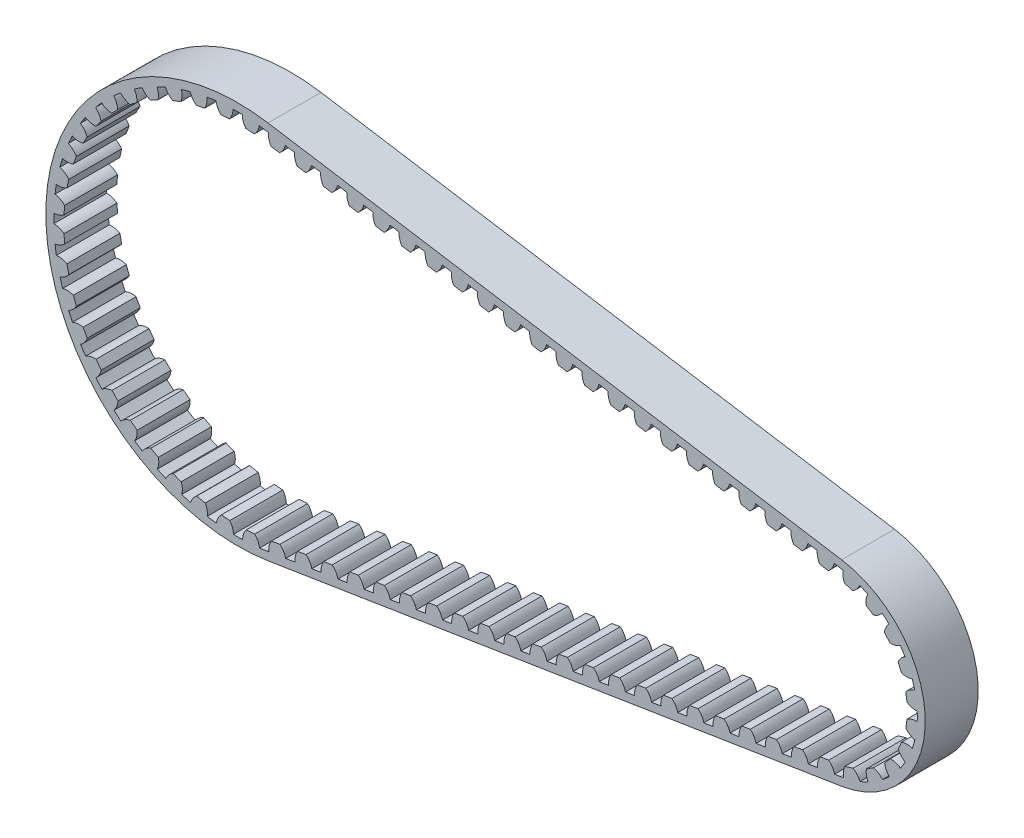
from build123d import *

# Parameters (mm, degrees)
EXTRUDE_1_DEPTH       = 10
EXTRUDE_1_2_DEPTH     = 10
PATTERN_START         = -10
PATTERN_CURVE_1_DEPTH = 10


# Read off the part's stored shape, not the designer's step: ｶｰﾌﾞ ﾊﾟﾀｰﾝ1
with BuildPart() as part:
    # ｽｹｯﾁ1 → Extrude 1 (new body)
    with BuildSketch(Plane.XY):
        with BuildLine():
            Line((5.715115212, -35.821039636), (114.074792623, -18.532651388))
            ThreePointArc((114.074792623, -18.532651388), (129.885019952, 0), (114.074792623, 18.532651388))
            Line((114.074792623, 18.532651388), (5.715115212, 35.821039636))
            ThreePointArc((5.715115212, 35.821039636), (-36.27408748, 0), (5.715115212, -35.821039636))
        make_face()
        with BuildLine():
            Line((5.478784723, -34.339773995), (113.838462135, -17.051385746))
            ThreePointArc((113.838462135, -17.051385746), (128.385019952, 0), (113.838462135, 17.051385746))
            Line((113.838462135, 17.051385746), (5.478784723, 34.339773995))
            ThreePointArc((5.478784723, 34.339773995), (-34.77408748, 0), (5.478784723, -34.339773995))
        make_face(mode=Mode.SUBTRACT)
    extrude(amount=-EXTRUDE_1_DEPTH)

    # ｽｹｯﾁ2 → Extrude 1 2 (add)
    with BuildSketch(Plane.XY):
        with BuildLine():
            Line((11.213338882, 31.490690165), (12.817473575, 31.234756371))
            ThreePointArc((12.817473575, 31.234756371), (13.570424199, 32.128030369), (13.95885104, 33.229845992))
            Line((13.95885104, 33.229845992), (10.749442151, 33.741895384))
            ThreePointArc((10.749442151, 33.741895384), (10.775731123, 32.573913377), (11.213338882, 31.490690165))
        make_face()
    extrude(amount=-EXTRUDE_1_2_DEPTH)

    # ｶｰﾌﾞ ﾊﾟﾀｰﾝ1 outline → ｶｰﾌﾞ ﾊﾟﾀｰﾝ1 (add)
    with BuildSketch(Plane.XY.offset(PATTERN_START)):
        with BuildLine():
            ThreePointArc((15.657944235, 32.715726509), (15.739692363, 31.668982078), (16.150891019, 30.70292187))
            Line((16.150891019, 30.70292187), (17.755025713, 30.446988076))
            ThreePointArc((17.755025713, 30.446988076), (18.44642053, 31.237133548), (18.849827475, 32.20647327))
            Line((18.849827475, 32.20647327), (15.657944235, 32.715726509))
        make_face()
        with BuildLine():
            Line((8.9747232, 33.782009861), (5.782839959, 34.2912631))
            ThreePointArc((5.782839959, 34.2912631), (5.864588088, 33.244518669), (6.275786744, 32.278458461))
            Line((6.275786744, 32.278458461), (7.879921437, 32.022524667))
            ThreePointArc((7.879921437, 32.022524667), (8.571316254, 32.812670139), (8.9747232, 33.782009861))
        make_face()
        with BuildLine():
            ThreePointArc((4.051314082, 34.537284408), (2.444801014, 34.688039842), (0.833024039, 34.764108374))
            ThreePointArc((0.833024039, 34.764108374), (1.012045507, 33.748367512), (1.500316257, 32.839868827))
            Line((1.500316257, 32.839868827), (3.120719704, 32.725663354))
            ThreePointArc((3.120719704, 32.725663354), (3.731591936, 33.556694823), (4.051314082, 34.537284408))
        make_face()
        with BuildLine():
            ThreePointArc((-0.905090499, 34.76230676), (-2.516706316, 34.682897073), (-4.122903406, 34.528811558))
            ThreePointArc((-4.122903406, 34.528811558), (-3.801149121, 33.548886884), (-3.18855542, 32.719123579))
            Line((-3.18855542, 32.719123579), (-1.56839221, 32.836688008))
            ThreePointArc((-1.56839221, 32.836688008), (-1.082005886, 33.746196957), (-0.905090499, 34.76230676))
        make_face()
        with BuildLine():
            ThreePointArc((-5.843070047, 34.279668792), (-7.426980762, 33.971710537), (-8.994900427, 33.590607711))
            ThreePointArc((-8.994900427, 33.590607711), (-8.536963315, 32.666447667), (-7.812517304, 31.932311329))
            Line((-7.812517304, 31.932311329), (-6.225576182, 32.279252387))
            ThreePointArc((-6.225576182, 32.279252387), (-5.873577189, 33.248723838), (-5.843070047, 34.279668792))
        make_face()
        with BuildLine():
            ThreePointArc((-10.66210154, 33.099195622), (-12.186063298, 32.568957941), (-13.683787214, 31.968595958))
            ThreePointArc((-13.683787214, 31.968595958), (-13.098989555, 31.119013777), (-12.277438865, 30.495449306))
            Line((-12.277438865, 30.495449306), (-10.756025376, 31.064704273))
            ThreePointArc((-10.756025376, 31.064704273), (-10.545579398, 32.074402582), (-10.66210154, 33.099195622))
        make_face()
        with BuildLine():
            ThreePointArc((-15.264083391, 31.24491828), (-16.697072726, 30.503195283), (-18.094111554, 29.695795782))
            ThreePointArc((-18.094111554, 29.695795782), (-17.394358141, 28.938086507), (-16.492427176, 28.437787876))
            Line((-16.492427176, 28.437787876), (-15.067512912, 29.217768363))
            ThreePointArc((-15.067512912, 29.217768363), (-15.002904021, 30.247138985), (-15.264083391, 31.24491828))
        make_face()
        with BuildLine():
            ThreePointArc((-19.555332523, 28.754584504), (-20.868177904, 27.816475532), (-22.136091962, 26.81847484))
            ThreePointArc((-22.136091962, 26.81847484), (-21.335627757, 26.168063246), (-20.37167723, 25.801215093))
            Line((-20.37167723, 25.801215093), (-19.072269335, 26.776042947))
            ThreePointArc((-19.072269335, 26.776042947), (-19.154812783, 27.804130863), (-19.555332523, 28.754584504))
        make_face()
        with BuildLine():
            ThreePointArc((-23.448491478, 25.678890309), (-24.61446716, 24.563492555), (-25.727445373, 23.395207087))
            ThreePointArc((-25.727445373, 23.395207087), (-24.842565519, 22.86533368), (-23.836218683, 22.639403976))
            Line((-23.836218683, 22.639403976), (-22.688769355, 23.789234511))
            ThreePointArc((-22.688769355, 23.789234511), (-22.916784795, 24.795110818), (-23.448491478, 25.678890309))
        make_face()
        with BuildLine():
            ThreePointArc((-26.864306766, 22.080447959), (-27.859676845, 20.810467706), (-28.795062188, 19.495680385))
            ThreePointArc((-28.795062188, 19.495680385), (-27.843780286, 19.097131858), (-26.815523461, 19.016719879))
            Line((-26.815523461, 19.016719879), (-25.843391459, 20.318145864))
            ThreePointArc((-25.843391459, 20.318145864), (-26.212237155, 21.281333819), (-26.864306766, 22.080447959))
        make_face()
        with BuildLine():
            ThreePointArc((-29.733242238, 18.032511363), (-30.537743851, 16.633801746), (-31.276494575, 15.199277851))
            ThreePointArc((-31.276494575, 15.199277851), (-30.278175982, 14.940167503), (-29.248941511, 15.006910206))
            Line((-29.248941511, 15.006910206), (-28.47191664, 16.433438359))
            ThreePointArc((-28.47191664, 16.433438359), (-28.974083956, 17.334330234), (-29.733242238, 18.032511363))
        make_face()
        with BuildLine():
            ThreePointArc((-31.996894642, 13.617484838), (-32.594150456, 12.118519551), (-33.121227726, 10.59346185))
            ThreePointArc((-33.121227726, 10.59346185), (-32.09619533, 10.479064421), (-31.086935459, 10.691603118))
            Line((-31.086935459, 10.691603118), (-30.520835704, 12.21419344))
            ThreePointArc((-30.520835704, 12.21419344), (-31.146101963, 13.034449674), (-31.996894642, 13.617484838))
        make_face()
        with BuildLine():
            ThreePointArc((-33.609182543, 8.925245591), (-33.987034151, 7.356539245), (-34.291708195, 5.771993516))
            ThreePointArc((-34.291708195, 5.771993516), (-33.260828699, 5.804637808), (-32.292089048, 6.158645822))
            Line((-32.292089048, 6.158645822), (-31.948438568, 7.746302765))
            ThreePointArc((-31.948438568, 7.746302765), (-32.684075152, 8.469225307), (-33.609182543, 8.925245591))
        make_face()
        with BuildLine():
            ThreePointArc((-34.537284408, 4.051314082), (-34.688039842, 2.444801014), (-34.764108374, 0.833024039))
            ThreePointArc((-34.764108374, 0.833024039), (-33.748367512, 1.012045507), (-32.839868827, 1.500316257))
            Line((-32.839868827, 1.500316257), (-32.725663354, 3.120719704))
            ThreePointArc((-32.725663354, 3.120719704), (-33.556694823, 3.731591936), (-34.537284408, 4.051314082))
        make_face()
        with BuildLine():
            ThreePointArc((-34.76230676, -0.905090499), (-34.682897073, -2.516706316), (-34.528811557, -4.122903406))
            ThreePointArc((-34.528811557, -4.122903406), (-33.548886884, -3.801149121), (-32.719123579, -3.18855542))
            Line((-32.719123579, -3.18855542), (-32.836688008, -1.56839221))
            ThreePointArc((-32.836688008, -1.56839221), (-33.746196957, -1.082005886), (-34.76230676, -0.905090499))
        make_face()
        with BuildLine():
            ThreePointArc((-34.279668792, -5.843070047), (-33.971710537, -7.426980762), (-33.590607711, -8.994900427))
            ThreePointArc((-33.590607711, -8.994900427), (-32.666447667, -8.536963315), (-31.932311329, -7.812517304))
            Line((-31.932311329, -7.812517304), (-32.279252387, -6.225576182))
            ThreePointArc((-32.279252387, -6.225576182), (-33.248723838, -5.873577189), (-34.279668792, -5.843070047))
        make_face()
        with BuildLine():
            ThreePointArc((-33.099195622, -10.66210154), (-32.568957941, -12.186063298), (-31.968595958, -13.683787214))
            ThreePointArc((-31.968595958, -13.683787214), (-31.119013777, -13.098989555), (-30.495449306, -12.277438865))
            Line((-30.495449306, -12.277438865), (-31.064704273, -10.756025376))
            ThreePointArc((-31.064704273, -10.756025376), (-32.074402582, -10.545579398), (-33.099195622, -10.66210154))
        make_face()
        with BuildLine():
            ThreePointArc((-31.24491828, -15.264083391), (-30.503195283, -16.697072726), (-29.695795782, -18.094111554))
            ThreePointArc((-29.695795782, -18.094111554), (-28.938086507, -17.394358141), (-28.437787876, -16.492427176))
            Line((-28.437787876, -16.492427176), (-29.217768363, -15.067512912))
            ThreePointArc((-29.217768363, -15.067512912), (-30.247138985, -15.002904021), (-31.24491828, -15.264083391))
        make_face()
        with BuildLine():
            ThreePointArc((-28.754584504, -19.555332523), (-27.816475532, -20.868177904), (-26.81847484, -22.136091962))
            ThreePointArc((-26.81847484, -22.136091962), (-26.168063246, -21.335627757), (-25.801215093, -20.37167723))
            Line((-25.801215093, -20.37167723), (-26.776042947, -19.072269335))
            ThreePointArc((-26.776042947, -19.072269335), (-27.804130863, -19.154812783), (-28.754584504, -19.555332523))
        make_face()
        with BuildLine():
            ThreePointArc((-25.678890309, -23.448491478), (-24.563492555, -24.61446716), (-23.395207087, -25.727445373))
            ThreePointArc((-23.395207087, -25.727445373), (-22.86533368, -24.842565519), (-22.639403976, -23.836218683))
            Line((-22.639403976, -23.836218683), (-23.789234511, -22.688769355))
            ThreePointArc((-23.789234511, -22.688769355), (-24.795110818, -22.916784795), (-25.678890309, -23.448491478))
        make_face()
        with BuildLine():
            ThreePointArc((-22.080447959, -26.864306766), (-20.810467706, -27.859676845), (-19.495680385, -28.795062188))
            ThreePointArc((-19.495680385, -28.795062188), (-19.097131858, -27.843780286), (-19.016719879, -26.815523461))
            Line((-19.016719879, -26.815523461), (-20.318145864, -25.843391459))
            ThreePointArc((-20.318145864, -25.843391459), (-21.281333819, -26.212237155), (-22.080447959, -26.864306766))
        make_face()
        with BuildLine():
            ThreePointArc((-18.032511363, -29.733242238), (-16.633801746, -30.537743851), (-15.199277851, -31.276494575))
            ThreePointArc((-15.199277851, -31.276494575), (-14.940167503, -30.278175982), (-15.006910206, -29.248941511))
            Line((-15.006910206, -29.248941511), (-16.433438359, -28.47191664))
            ThreePointArc((-16.433438359, -28.47191664), (-17.334330234, -28.974083956), (-18.032511363, -29.733242238))
        make_face()
        with BuildLine():
            ThreePointArc((-13.617484838, -31.996894642), (-12.118519551, -32.594150456), (-10.59346185, -33.121227726))
            ThreePointArc((-10.59346185, -33.121227726), (-10.479064421, -32.09619533), (-10.691603118, -31.086935459))
            Line((-10.691603118, -31.086935459), (-12.21419344, -30.520835704))
            ThreePointArc((-12.21419344, -30.520835704), (-13.034449674, -31.146101963), (-13.617484838, -31.996894642))
        make_face()
        with BuildLine():
            ThreePointArc((-8.925245591, -33.609182543), (-7.356539245, -33.987034151), (-5.771993516, -34.291708195))
            ThreePointArc((-5.771993516, -34.291708195), (-5.804637808, -33.260828699), (-6.158645822, -32.292089048))
            Line((-6.158645822, -32.292089048), (-7.746302765, -31.948438568))
            ThreePointArc((-7.746302765, -31.948438568), (-8.469225307, -32.684075152), (-8.925245591, -33.609182543))
        make_face()
        with BuildLine():
            ThreePointArc((-4.051314082, -34.537284408), (-2.444801014, -34.688039842), (-0.833024039, -34.764108374))
            ThreePointArc((-0.833024039, -34.764108374), (-1.012045507, -33.748367512), (-1.500316257, -32.839868827))
            Line((-1.500316257, -32.839868827), (-3.120719704, -32.725663354))
            ThreePointArc((-3.120719704, -32.725663354), (-3.731591936, -33.556694823), (-4.051314082, -34.537284408))
        make_face()
        with BuildLine():
            ThreePointArc((0.905090499, -34.76230676), (2.516706316, -34.682897073), (4.122903406, -34.528811558))
            ThreePointArc((4.122903406, -34.528811558), (3.801149121, -33.548886884), (3.18855542, -32.719123579))
            Line((3.18855542, -32.719123579), (1.56839221, -32.836688008))
            ThreePointArc((1.56839221, -32.836688008), (1.082005886, -33.746196957), (0.905090499, -34.76230676))
        make_face()
        with BuildLine():
            Line((5.85451991, -34.279826827), (9.04640315, -33.770573588))
            ThreePointArc((9.04640315, -33.770573588), (8.642996205, -32.801233866), (7.951601388, -32.011088394))
            Line((7.951601388, -32.011088394), (6.347466694, -32.267022188))
            ThreePointArc((6.347466694, -32.267022188), (5.936268039, -33.233082396), (5.85451991, -34.279826827))
        make_face()
        with BuildLine():
            Line((10.792072047, -33.492058532), (13.983955288, -32.982805293))
            ThreePointArc((13.983955288, -32.982805293), (13.580548343, -32.013465571), (12.889153526, -31.223320099))
            Line((12.889153526, -31.223320099), (11.285018832, -31.479253893))
            ThreePointArc((11.285018832, -31.479253893), (10.873820176, -32.445314101), (10.792072047, -33.492058532))
        make_face()
        with BuildLine():
            Line((15.729624185, -32.704290237), (18.921507426, -32.195036997))
            ThreePointArc((18.921507426, -32.195036997), (18.518100481, -31.225697275), (17.826705663, -30.435551803))
            Line((17.826705663, -30.435551803), (16.22257097, -30.691485598))
            ThreePointArc((16.22257097, -30.691485598), (15.811372314, -31.657545806), (15.729624185, -32.704290237))
        make_face()
        with BuildLine():
            Line((20.667176323, -31.916521941), (23.859059564, -31.407268702))
            ThreePointArc((23.859059564, -31.407268702), (23.455652618, -30.43792898), (22.764257801, -29.647783508))
            Line((22.764257801, -29.647783508), (21.160123108, -29.903717302))
            ThreePointArc((21.160123108, -29.903717302), (20.748924452, -30.86977751), (20.667176323, -31.916521941))
        make_face()
        with BuildLine():
            Line((25.604728461, -31.128753646), (28.796611701, -30.619500407))
            ThreePointArc((28.796611701, -30.619500407), (28.393204756, -29.650160685), (27.701809939, -28.860015213))
            Line((27.701809939, -28.860015213), (26.097675245, -29.115949007))
            ThreePointArc((26.097675245, -29.115949007), (25.68647659, -30.082009215), (25.604728461, -31.128753646))
        make_face()
        with BuildLine():
            Line((30.542280598, -30.340985351), (33.734163839, -29.831732111))
            ThreePointArc((33.734163839, -29.831732111), (33.330756894, -28.862392389), (32.639362077, -28.072246917))
            Line((32.639362077, -28.072246917), (31.035227383, -28.328180712))
            ThreePointArc((31.035227383, -28.328180712), (30.624028727, -29.29424092), (30.542280598, -30.340985351))
        make_face()
        with BuildLine():
            Line((35.479832736, -29.553217055), (38.671715977, -29.043963816))
            ThreePointArc((38.671715977, -29.043963816), (38.268309032, -28.074624094), (37.576914214, -27.284478622))
            Line((37.576914214, -27.284478622), (35.972779521, -27.540412416))
            ThreePointArc((35.972779521, -27.540412416), (35.561580865, -28.506472624), (35.479832736, -29.553217055))
        make_face()
        with BuildLine():
            Line((40.417384874, -28.76544876), (43.609268115, -28.256195521))
            ThreePointArc((43.609268115, -28.256195521), (43.205861169, -27.286855799), (42.514466352, -26.496710327))
            Line((42.514466352, -26.496710327), (40.910331659, -26.752644121))
            ThreePointArc((40.910331659, -26.752644121), (40.499133003, -27.718704329), (40.417384874, -28.76544876))
        make_face()
        with BuildLine():
            Line((45.354937012, -27.977680465), (48.546820252, -27.468427225))
            ThreePointArc((48.546820252, -27.468427225), (48.143413307, -26.499087503), (47.45201849, -25.708942031))
            Line((47.45201849, -25.708942031), (45.847883796, -25.964875826))
            ThreePointArc((45.847883796, -25.964875826), (45.436685141, -26.930936034), (45.354937012, -27.977680465))
        make_face()
        with BuildLine():
            Line((50.292489149, -27.189912169), (53.48437239, -26.68065893))
            ThreePointArc((53.48437239, -26.68065893), (53.080965445, -25.711319208), (52.389570628, -24.921173736))
            Line((52.389570628, -24.921173736), (50.785435934, -25.17710753))
            ThreePointArc((50.785435934, -25.17710753), (50.374237278, -26.143167738), (50.292489149, -27.189912169))
        make_face()
        with BuildLine():
            Line((55.230041287, -26.402143874), (58.421924528, -25.892890635))
            ThreePointArc((58.421924528, -25.892890635), (58.018517582, -24.923550913), (57.327122765, -24.133405441))
            Line((57.327122765, -24.133405441), (55.722988072, -24.389339235))
            ThreePointArc((55.722988072, -24.389339235), (55.311789416, -25.355399443), (55.230041287, -26.402143874))
        make_face()
        with BuildLine():
            Line((60.167593425, -25.614375579), (63.359476665, -25.10512234))
            ThreePointArc((63.359476665, -25.10512234), (62.95606972, -24.135782617), (62.264674903, -23.345637145))
            Line((62.264674903, -23.345637145), (60.66054021, -23.60157094))
            ThreePointArc((60.66054021, -23.60157094), (60.249341554, -24.567631148), (60.167593425, -25.614375579))
        make_face()
        with BuildLine():
            Line((65.105145563, -24.826607283), (68.297028803, -24.317354044))
            ThreePointArc((68.297028803, -24.317354044), (67.893621858, -23.348014322), (67.202227041, -22.55786885))
            Line((67.202227041, -22.55786885), (65.598092347, -22.813802644))
            ThreePointArc((65.598092347, -22.813802644), (65.186893691, -23.779862852), (65.105145563, -24.826607283))
        make_face()
        with BuildLine():
            Line((70.0426977, -24.038838988), (73.234580941, -23.529585749))
            ThreePointArc((73.234580941, -23.529585749), (72.831173996, -22.560246027), (72.139779179, -21.770100555))
            Line((72.139779179, -21.770100555), (70.535644485, -22.026034349))
            ThreePointArc((70.535644485, -22.026034349), (70.124445829, -22.992094557), (70.0426977, -24.038838988))
        make_face()
        with BuildLine():
            Line((74.980249838, -23.251070693), (78.172133079, -22.741817454))
            ThreePointArc((78.172133079, -22.741817454), (77.768726133, -21.772477732), (77.077331316, -20.982332259))
            Line((77.077331316, -20.982332259), (75.473196623, -21.238266054))
            ThreePointArc((75.473196623, -21.238266054), (75.061997967, -22.204326262), (74.980249838, -23.251070693))
        make_face()
        with BuildLine():
            Line((79.917801976, -22.463302397), (83.109685216, -21.954049158))
            ThreePointArc((83.109685216, -21.954049158), (82.706278271, -20.984709436), (82.014883454, -20.194563964))
            Line((82.014883454, -20.194563964), (80.410748761, -20.450497758))
            ThreePointArc((80.410748761, -20.450497758), (79.999550105, -21.416557966), (79.917801976, -22.463302397))
        make_face()
        with BuildLine():
            Line((84.855354114, -21.675534102), (88.047237354, -21.166280863))
            ThreePointArc((88.047237354, -21.166280863), (87.643830409, -20.196941141), (86.952435592, -19.406795669))
            Line((86.952435592, -19.406795669), (85.348300898, -19.662729463))
            ThreePointArc((85.348300898, -19.662729463), (84.937102242, -20.628789671), (84.855354114, -21.675534102))
        make_face()
        with BuildLine():
            Line((89.792906251, -20.887765807), (92.984789492, -20.378512568))
            ThreePointArc((92.984789492, -20.378512568), (92.581382547, -19.409172846), (91.88998773, -18.619027373))
            Line((91.88998773, -18.619027373), (90.285853036, -18.874961168))
            ThreePointArc((90.285853036, -18.874961168), (89.87465438, -19.841021376), (89.792906251, -20.887765807))
        make_face()
        with BuildLine():
            Line((94.730458389, -20.099997511), (97.92234163, -19.590744272))
            ThreePointArc((97.92234163, -19.590744272), (97.518934684, -18.62140455), (96.827539867, -17.831259078))
            Line((96.827539867, -17.831259078), (95.223405174, -18.087192872))
            ThreePointArc((95.223405174, -18.087192872), (94.812206518, -19.05325308), (94.730458389, -20.099997511))
        make_face()
        with BuildLine():
            Line((99.668010527, -19.312229216), (102.859893767, -18.802975977))
            ThreePointArc((102.859893767, -18.802975977), (102.456486822, -17.833636255), (101.765092005, -17.043490783))
            Line((101.765092005, -17.043490783), (100.160957312, -17.299424577))
            ThreePointArc((100.160957312, -17.299424577), (99.749758656, -18.265484785), (99.668010527, -19.312229216))
        make_face()
        with BuildLine():
            Line((104.605562664, -18.524460921), (107.797445905, -18.015207682))
            ThreePointArc((107.797445905, -18.015207682), (107.39403896, -17.04586796), (106.702644143, -16.255722487))
            Line((106.702644143, -16.255722487), (105.098509449, -16.511656282))
            ThreePointArc((105.098509449, -16.511656282), (104.687310793, -17.47771649), (104.605562664, -18.524460921))
        make_face()
        with BuildLine():
            Line((109.543114802, -17.736692625), (112.734998043, -17.227439386))
            ThreePointArc((112.734998043, -17.227439386), (112.331591098, -16.258099664), (111.64019628, -15.467954192))
            Line((111.64019628, -15.467954192), (110.036061587, -15.723887986))
            ThreePointArc((110.036061587, -15.723887986), (109.624862931, -16.689948194), (109.543114802, -17.736692625))
        make_face()
        with BuildLine():
            ThreePointArc((114.45213302, -16.942083635), (116.016999865, -16.557486729), (117.539199014, -16.028683578))
            ThreePointArc((117.539199014, -16.028683578), (117.017469209, -15.160750594), (116.253927875, -14.495533123))
            Line((116.253927875, -14.495533123), (114.696257472, -14.956416122))
            ThreePointArc((114.696257472, -14.956416122), (114.417603537, -15.929997982), (114.45213302, -16.942083635))
        make_face()
        with BuildLine():
            ThreePointArc((119.090212783, -15.316469684), (120.483338055, -14.506577717), (121.79489638, -13.570341751))
            ThreePointArc((121.79489638, -13.570341751), (121.049775319, -12.884554424), (120.129749355, -12.461397386))
            Line((120.129749355, -12.461397386), (118.765021294, -13.342457851))
            ThreePointArc((118.765021294, -13.342457851), (118.771944508, -14.355108691), (119.090212783, -15.316469684))
        make_face()
        with BuildLine():
            ThreePointArc((123.082429352, -12.450006449), (124.190950327, -11.280432053), (125.185613172, -10.012611542))
            ThreePointArc((125.185613172, -10.012611542), (124.277466133, -9.564528281), (123.27549057, -9.417713345))
            Line((123.27549057, -9.417713345), (122.214267002, -10.647572996))
            ThreePointArc((122.214267002, -10.647572996), (122.506206488, -11.617253866), (123.082429352, -12.450006449))
        make_face()
        with BuildLine():
            ThreePointArc((126.105357083, -8.574917735), (126.839467984, -7.140412871), (127.43665368, -5.643719093))
            ThreePointArc((127.43665368, -5.643719093), (126.439053335, -5.46964094), (125.436302275, -5.611062177))
            Line((125.436302275, -5.611062177), (124.764557222, -7.0900851))
            ThreePointArc((124.764557222, -7.0900851), (125.317861779, -7.938238224), (126.105357083, -8.574917735))
        make_face()
        with BuildLine():
            ThreePointArc((127.914096348, -4.005140184), (128.214323877, -2.421919905), (128.365651992, -0.817606088))
            ThreePointArc((128.365651992, -0.817606088), (127.359417986, -0.931635819), (126.437128357, -1.349836122))
            Line((126.437128357, -1.349836122), (126.209282609, -2.958200675))
            ThreePointArc((126.209282609, -2.958200675), (126.979126791, -3.616113731), (127.914096348, -4.005140184))
        make_face()
        with BuildLine():
            ThreePointArc((128.362113851, 0.889110007), (128.204135359, 2.49278261), (127.897346187, 4.074744501))
            ThreePointArc((127.897346187, 4.074744501), (126.963997617, 3.681844896), (126.196887839, 3.020745628))
            Line((126.196887839, 3.020745628), (126.431400102, 1.413339575))
            ThreePointArc((126.431400102, 1.413339575), (127.355415713, 0.99896679), (128.362113851, 0.889110007))
        make_face()
        with BuildLine():
            ThreePointArc((127.413113877, 5.711329792), (126.809727841, 7.205534701), (126.069675619, 8.636983523))
            ThreePointArc((126.069675619, 8.636983523), (125.284826834, 7.997044434), (124.735043578, 7.146604532))
            Line((124.735043578, 7.146604532), (125.412915065, 5.670379458))
            ThreePointArc((125.412915065, 5.670379458), (126.416243855, 5.533116963), (127.413113877, 5.711329792))
        make_face()
        with BuildLine():
            ThreePointArc((125.143978761, 10.070851604), (124.144067929, 11.334537225), (123.030707285, 12.499505507))
            ThreePointArc((123.030707285, 12.499505507), (122.457942066, 11.664370992), (122.170025504, 10.693488039))
            Line((122.170025504, 10.693488039), (123.236339097, 9.46803892))
            ThreePointArc((123.236339097, 9.46803892), (124.237697335, 9.619006906), (125.143978761, 10.070851604))
        make_face()
        with BuildLine():
            ThreePointArc((121.738540334, 13.614492912), (120.423111535, 14.545282951), (119.026640327, 15.349391891))
            ThreePointArc((119.026640327, 15.349391891), (118.712360707, 14.386719582), (118.709636125, 13.374048742))
            Line((118.709636125, 13.374048742), (120.078005438, 12.498654178))
            ThreePointArc((120.078005438, 12.498654178), (120.996269035, 12.925622117), (121.738540334, 13.614492912))
        make_face()
        with BuildLine():
            ThreePointArc((117.472686965, 16.055168973), (115.948308417, 16.577656357), (114.381860438, 16.955761831))
            ThreePointArc((114.381860438, 16.955761831), (114.351527481, 15.943541714), (114.634215609, 14.971123555))
            Line((114.634215609, 14.971123555), (116.193783499, 14.516702807))
            ThreePointArc((116.193783499, 14.516702807), (116.954560199, 15.185080295), (117.472686965, 16.055168973))
        make_face()
        with BuildLine():
            Line((112.663318092, 17.238875659), (109.471434852, 17.748128898))
            ThreePointArc((109.471434852, 17.748128898), (109.55318298, 16.701384467), (109.964381636, 15.735324259))
            Line((109.964381636, 15.735324259), (111.56851633, 15.479390465))
            ThreePointArc((111.56851633, 15.479390465), (112.259911147, 16.269535937), (112.663318092, 17.238875659))
        make_face()
        with BuildLine():
            Line((107.725765954, 18.026643954), (104.533882714, 18.535897193))
            ThreePointArc((104.533882714, 18.535897193), (104.615630843, 17.489152762), (105.026829499, 16.523092554))
            Line((105.026829499, 16.523092554), (106.630964192, 16.26715876))
            ThreePointArc((106.630964192, 16.26715876), (107.322359009, 17.057304232), (107.725765954, 18.026643954))
        make_face()
        with BuildLine():
            Line((102.788213817, 18.81441225), (99.596330576, 19.323665489))
            ThreePointArc((99.596330576, 19.323665489), (99.678078705, 18.276921058), (100.089277361, 17.31086085))
            Line((100.089277361, 17.31086085), (101.693412054, 17.054927055))
            ThreePointArc((101.693412054, 17.054927055), (102.384806871, 17.845072528), (102.788213817, 18.81441225))
        make_face()
        with BuildLine():
            Line((97.850661679, 19.602180545), (94.658778438, 20.111433784))
            ThreePointArc((94.658778438, 20.111433784), (94.740526567, 19.064689353), (95.151725223, 18.098629145))
            Line((95.151725223, 18.098629145), (96.755859917, 17.842695351))
            ThreePointArc((96.755859917, 17.842695351), (97.447254734, 18.632840823), (97.850661679, 19.602180545))
        make_face()
        with BuildLine():
            Line((92.913109541, 20.38994884), (89.721226301, 20.899202079))
            ThreePointArc((89.721226301, 20.899202079), (89.80297443, 19.852457648), (90.214173085, 18.88639744))
            Line((90.214173085, 18.88639744), (91.818307779, 18.630463646))
            ThreePointArc((91.818307779, 18.630463646), (92.509702596, 19.420609118), (92.913109541, 20.38994884))
        make_face()
        with BuildLine():
            Line((87.975557404, 21.177717136), (84.783674163, 21.686970375))
            ThreePointArc((84.783674163, 21.686970375), (84.865422292, 20.640225944), (85.276620948, 19.674165736))
            Line((85.276620948, 19.674165736), (86.880755641, 19.418231941))
            ThreePointArc((86.880755641, 19.418231941), (87.572150458, 20.208377414), (87.975557404, 21.177717136))
        make_face()
        with BuildLine():
            Line((83.038005266, 21.965485431), (79.846122025, 22.47473867))
            ThreePointArc((79.846122025, 22.47473867), (79.927870154, 21.427994239), (80.33906881, 20.461934031))
            Line((80.33906881, 20.461934031), (81.943203503, 20.206000237))
            ThreePointArc((81.943203503, 20.206000237), (82.63459832, 20.996145709), (83.038005266, 21.965485431))
        make_face()
        with BuildLine():
            Line((78.100453128, 22.753253726), (74.908569887, 23.262506965))
            ThreePointArc((74.908569887, 23.262506965), (74.990318016, 22.215762534), (75.401516672, 21.249702326))
            Line((75.401516672, 21.249702326), (77.005651366, 20.993768532))
            ThreePointArc((77.005651366, 20.993768532), (77.697046183, 21.783914004), (78.100453128, 22.753253726))
        make_face()
        with BuildLine():
            Line((73.16290099, 23.541022022), (69.97101775, 24.050275261))
            ThreePointArc((69.97101775, 24.050275261), (70.052765879, 23.00353083), (70.463964534, 22.037470622))
            Line((70.463964534, 22.037470622), (72.068099228, 21.781536827))
            ThreePointArc((72.068099228, 21.781536827), (72.759494045, 22.571682299), (73.16290099, 23.541022022))
        make_face()
        with BuildLine():
            Line((68.225348853, 24.328790317), (65.033465612, 24.838043556))
            ThreePointArc((65.033465612, 24.838043556), (65.115213741, 23.791299125), (65.526412397, 22.825238917))
            Line((65.526412397, 22.825238917), (67.13054709, 22.569305123))
            ThreePointArc((67.13054709, 22.569305123), (67.821941907, 23.359450595), (68.225348853, 24.328790317))
        make_face()
        with BuildLine():
            Line((63.287796715, 25.116558612), (60.095913474, 25.625811851))
            ThreePointArc((60.095913474, 25.625811851), (60.177661603, 24.57906742), (60.588860259, 23.613007212))
            Line((60.588860259, 23.613007212), (62.192994952, 23.357073418))
            ThreePointArc((62.192994952, 23.357073418), (62.88438977, 24.14721889), (63.287796715, 25.116558612))
        make_face()
        with BuildLine():
            Line((58.350244577, 25.904326908), (55.158361336, 26.413580147))
            ThreePointArc((55.158361336, 26.413580147), (55.240109465, 25.366835716), (55.651308121, 24.400775508))
            Line((55.651308121, 24.400775508), (57.255442815, 24.144841713))
            ThreePointArc((57.255442815, 24.144841713), (57.946837632, 24.934987185), (58.350244577, 25.904326908))
        make_face()
        with BuildLine():
            Line((53.412692439, 26.692095203), (50.220809199, 27.201348442))
            ThreePointArc((50.220809199, 27.201348442), (50.302557328, 26.154604011), (50.713755983, 25.188543803))
            Line((50.713755983, 25.188543803), (52.317890677, 24.932610009))
            ThreePointArc((52.317890677, 24.932610009), (53.009285494, 25.722755481), (53.412692439, 26.692095203))
        make_face()
        with BuildLine():
            Line((48.475140302, 27.479863498), (45.283257061, 27.989116737))
            ThreePointArc((45.283257061, 27.989116737), (45.36500519, 26.942372306), (45.776203846, 25.976312098))
            Line((45.776203846, 25.976312098), (47.380338539, 25.720378304))
            ThreePointArc((47.380338539, 25.720378304), (48.071733356, 26.510523776), (48.475140302, 27.479863498))
        make_face()
        with BuildLine():
            Line((43.537588164, 28.267631793), (40.345704923, 28.776885033))
            ThreePointArc((40.345704923, 28.776885033), (40.427453052, 27.730140602), (40.838651708, 26.764080394))
            Line((40.838651708, 26.764080394), (42.442786401, 26.508146599))
            ThreePointArc((42.442786401, 26.508146599), (43.134181219, 27.298292071), (43.537588164, 28.267631793))
        make_face()
        with BuildLine():
            Line((38.600036026, 29.055400089), (35.408152785, 29.564653328))
            ThreePointArc((35.408152785, 29.564653328), (35.489900914, 28.517908897), (35.90109957, 27.551848689))
            Line((35.90109957, 27.551848689), (37.505234264, 27.295914895))
            ThreePointArc((37.505234264, 27.295914895), (38.196629081, 28.086060367), (38.600036026, 29.055400089))
        make_face()
        with BuildLine():
            Line((33.662483888, 29.843168384), (30.470600648, 30.352421623))
            ThreePointArc((30.470600648, 30.352421623), (30.552348777, 29.305677192), (30.963547433, 28.339616984))
            Line((30.963547433, 28.339616984), (32.567682126, 28.08368319))
            ThreePointArc((32.567682126, 28.08368319), (33.259076943, 28.873828662), (33.662483888, 29.843168384))
        make_face()
        with BuildLine():
            Line((28.724931751, 30.630936679), (25.53304851, 31.140189919))
            ThreePointArc((25.53304851, 31.140189919), (25.614796639, 30.093445488), (26.025995295, 29.12738528))
            Line((26.025995295, 29.12738528), (27.630129988, 28.871451485))
            ThreePointArc((27.630129988, 28.871451485), (28.321524805, 29.661596957), (28.724931751, 30.630936679))
        make_face()
        with BuildLine():
            Line((23.787379613, 31.418704975), (20.595496372, 31.927958214))
            ThreePointArc((20.595496372, 31.927958214), (20.677244501, 30.881213783), (21.088443157, 29.915153575))
            Line((21.088443157, 29.915153575), (22.692577851, 29.659219781))
            ThreePointArc((22.692577851, 29.659219781), (23.383972668, 30.449365253), (23.787379613, 31.418704975))
        make_face()
    extrude(amount=PATTERN_CURVE_1_DEPTH)


solid = part.part
